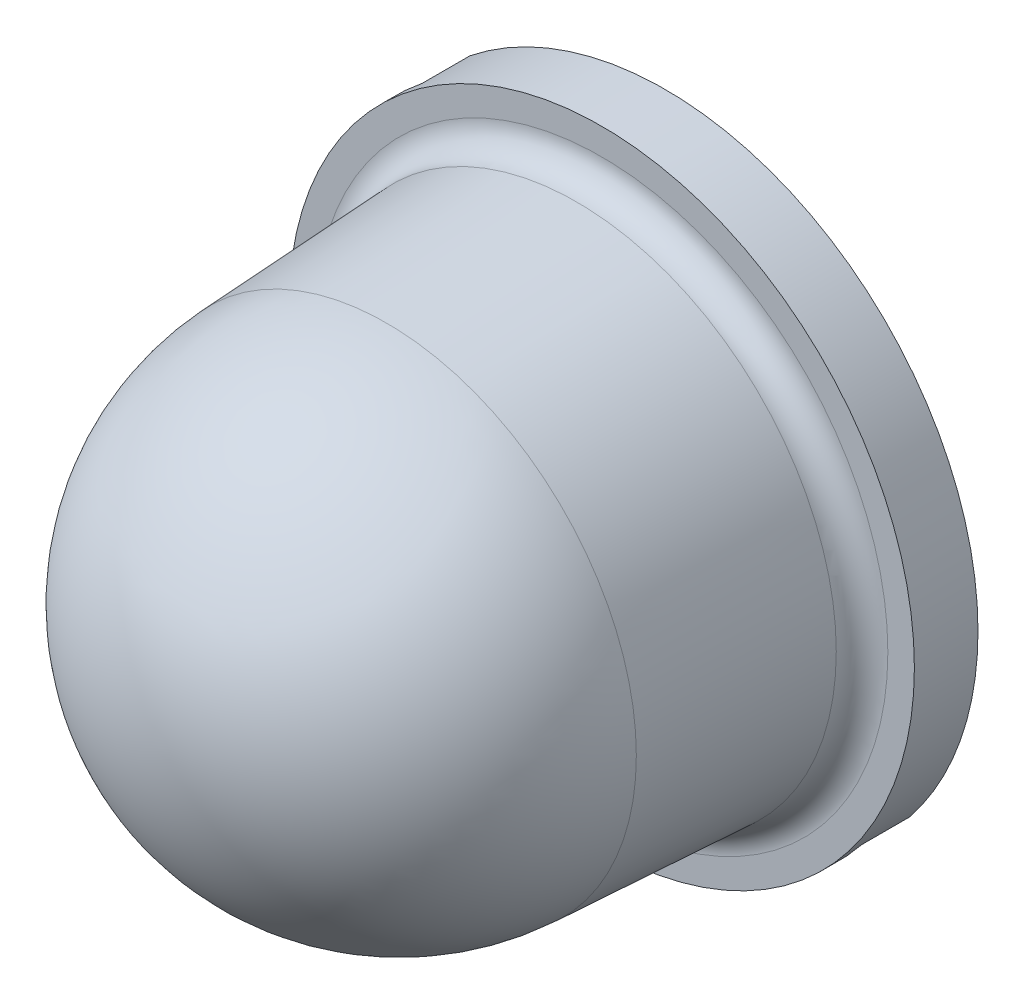
from build123d import *

# Parameters (mm, degrees)
CUT_EXTRUDE_START   = -0.9
CUT_EXTRUDE_2_DEPTH = 0.9


with BuildPart() as part:
    # Эскиз1 → Повернуть1 (revolve)
    with BuildSketch(Plane(origin=(0, 0, 0), x_dir=(1, 0, 0), z_dir=(0, 1, 0))):
        with BuildLine():
            Line((-5.9, 0), (-4.8, 0))
            Line((-4.8, 0), (-4.8, -0.7))
            Line((-4.8, -0.7), (-4.1, -0.7))
            Line((-4.1, -0.7), (-4.1, -5.011389544))
            ThreePointArc((-4.1, -5.011389544), (-2.899137803, -7.910527347), (0, -9.111389544))
            Line((0, -9.111389544), (0, -9.73))
            ThreePointArc((0, -9.73), (-3.248077098, -8.434148636), (-4.712143764, -5.258342534))
            Line((-4.712143764, -5.258342534), (-4.9, -1.673832022))
            ThreePointArc((-4.9, -1.673832022), (-5.05513748, -1.337312814), (-5.399314767, -1.2))
            Line((-5.399314767, -1.2), (-5.9, -1.2))
            Line((-5.9, -1.2), (-5.9, 0))
        make_face()
    revolve(axis=Axis((0, 0, 9.111389544), (0, 0, -1)))

    # Эскиз4 → Вырез-Вытянуть2 (cut)
    with BuildSketch(Plane(origin=(0, 0, 0), x_dir=(-1, 0, 0), z_dir=(0, 0, -1)).offset(CUT_EXTRUDE_START)):
        with BuildLine():
            Line((-3.712310601, -4.631549417), (-2.903229087, -3.822467903))
            ThreePointArc((-2.903229087, -3.822467903), (-3.39411255, -3.39411255), (-3.822467903, -2.903229087))
            Line((-3.822467903, -2.903229087), (-4.631549417, -3.712310601))
            Line((-4.631549417, -3.712310601), (-3.712310601, -4.631549417))
        make_face()
        with BuildLine():
            Line((2.903229087, 3.822467903), (3.712310601, 4.631549417))
            Line((3.712310601, 4.631549417), (4.631549417, 3.712310601))
            Line((4.631549417, 3.712310601), (3.822467903, 2.903229087))
            ThreePointArc((3.822467903, 2.903229087), (3.39411255, 3.39411255), (2.903229087, 3.822467903))
        make_face()
    extrude(amount=CUT_EXTRUDE_2_DEPTH, mode=Mode.SUBTRACT)


solid = part.part
